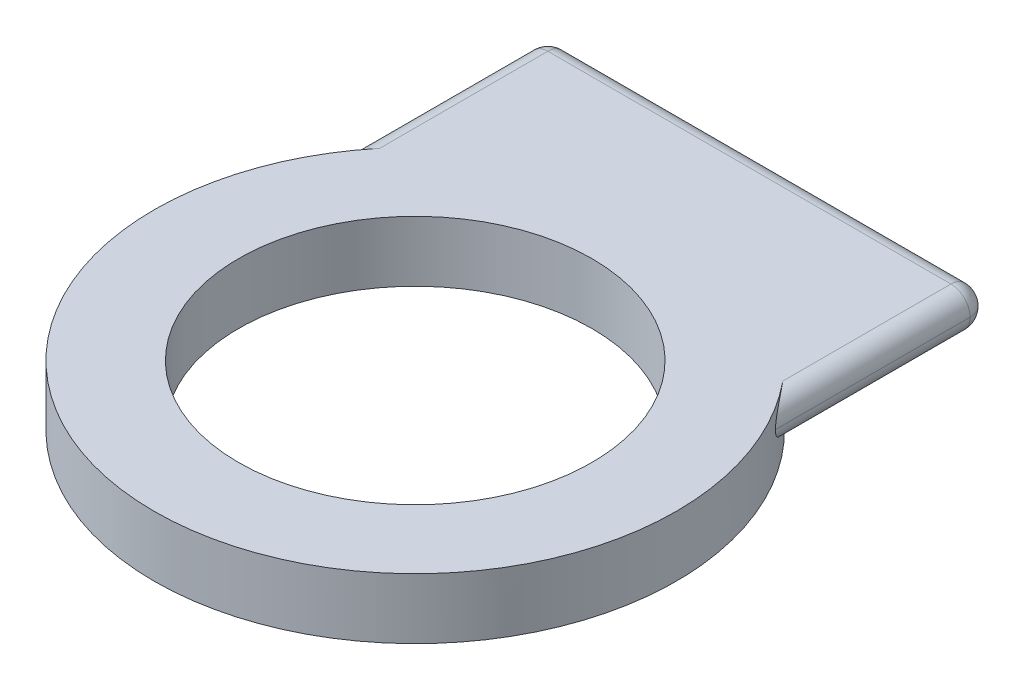
from build123d import *

# Parameters (mm, degrees)
SKETCH1_W           = 87.47
SKETCH1_H           = 70
BOSS_EXTRUDE1_DEPTH = 7.6
SKETCH2_R           = 43.735
BOSS_EXTRUDE2_DEPTH = 12
SKETCH3_R           = 51.735
BOSS_EXTRUDE3_DEPTH = 12
SKETCH4_R           = 35
CUT_EXTRUDE1_DEPTH  = 12
FILLET1_R           = 3.8
FILLET2_R           = 3.8


with BuildPart() as part:
    # Sketch1 → Boss-Extrude1 (new body)
    with BuildSketch(Plane(origin=(0, 0, 0), x_dir=(1, 0, 0), z_dir=(0, 1, 0))):
        with Locations((43.735, 35)):
            Rectangle(SKETCH1_W, SKETCH1_H)
    extrude(amount=BOSS_EXTRUDE1_DEPTH)

    # Sketch2 → Boss-Extrude2 (add)
    with BuildSketch(Plane(origin=(0, 7.6, 0), x_dir=(1, 0, 0), z_dir=(0, 1, 0))):
        with Locations(Location((43.735, 0, 0), (0, 0, 270))):
            Circle(SKETCH2_R)
    extrude(amount=-BOSS_EXTRUDE2_DEPTH)

    # Sketch3 → Boss-Extrude3 (add)
    with BuildSketch(Plane(origin=(0, 7.6, 0), x_dir=(1, 0, 0), z_dir=(0, 1, 0))):
        with Locations(Location((43.735, 0, 0), (0, 0, 270))):
            Circle(SKETCH3_R)
    extrude(amount=-BOSS_EXTRUDE3_DEPTH)

    # Sketch4 → Cut-Extrude1 (cut)
    with BuildSketch(Plane(origin=(0, 7.6, 0), x_dir=(1, 0, 0), z_dir=(0, 1, 0))):
        with Locations(Location((43.735, 0, 0), (0, 0, 270))):
            Circle(SKETCH4_R)
    extrude(amount=-CUT_EXTRUDE1_DEPTH, mode=Mode.SUBTRACT)

    # Fillet1
    fillet1_edges = [part.edges().sort_by_distance(p)[0] for p in [
        (87.47, 0, -48.818104067),
        (87.47, 7.6, -48.818104067),
        (0, 7.6, -48.818104067),
        (0, 0, -48.818104067),
    ]]
    fillet(fillet1_edges, radius=FILLET1_R - 0.0001)  # a hair under: the kernel refuses the full size

    # Fillet2
    fillet2_edges = [part.edges().sort_by_distance(p)[0] for p in [
        (43.735, 7.6, -70),
        (43.735, 0, -70),
        (86.357035058, 6.487035058, -70),
        (86.357035058, 1.112964942, -70),
        (1.112964942, 1.112964942, -70),
        (1.112964942, 6.487035058, -70),
    ]]
    fillet(fillet2_edges, radius=FILLET2_R - 0.0001)  # a hair under: the kernel refuses the full size


solid = part.part
